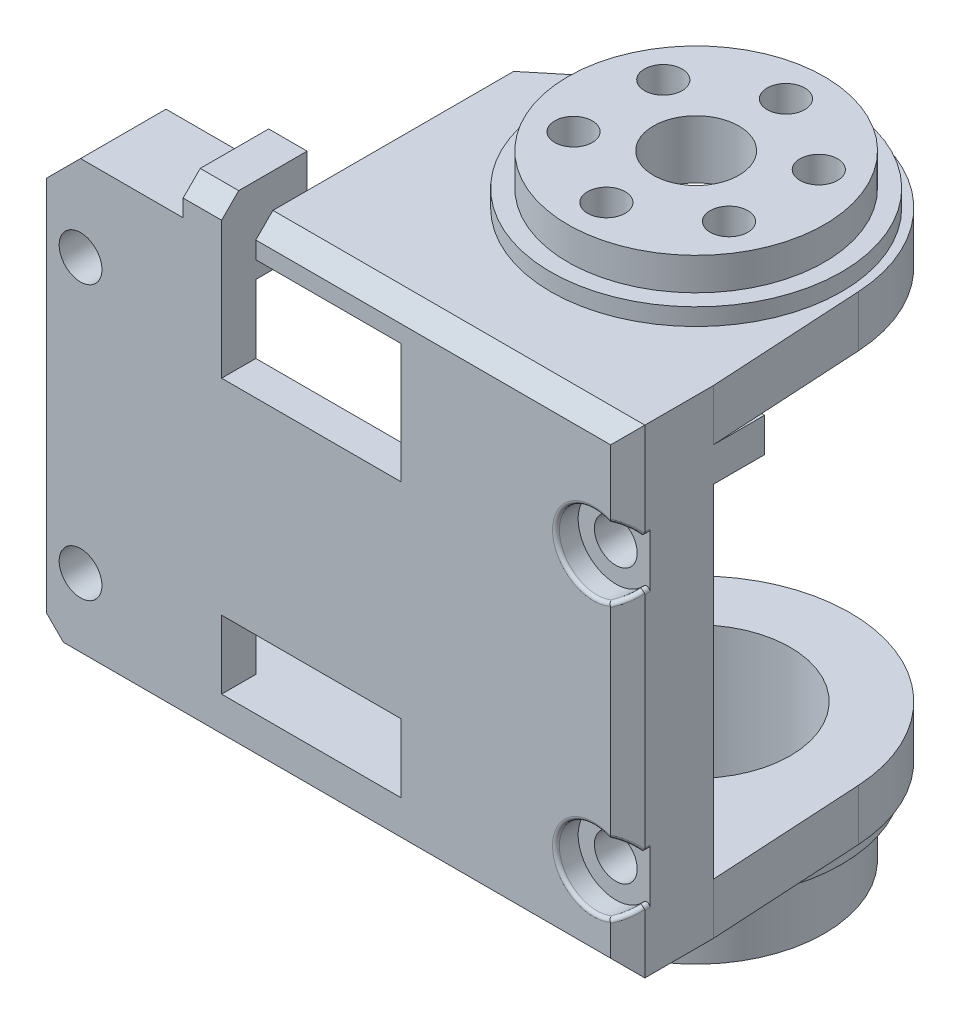
from build123d import *

# Parameters (mm, degrees)
SKETCH_1_W                     = 8
SKETCH_1_H                     = 2
EXTRUDE_1_DEPTH                = 2
SKETCH_2_W                     = 34
SKETCH_2_H                     = 2
SKETCH_2_R                     = 9
EXTRUDE_2_DEPTH                = 3
SKETCH_4_R                     = 7.5
EXTRUDE_3_DEPTH                = 5
SKETCH_5_R                     = 8.5
EXTRUDE_4_DEPTH                = 1
SKETCH_6_R                     = 7.5
CUT_EXTRUDE_1_DEPTH            = 2.1
CUT_EXTRUDE_2_DEPTH            = 45.014202253
CUT_EXTRUDE_2_DEPTH_BACK       = 45.014202253
SKETCH_7_W                     = 10.5
SKETCH_7_H                     = 4
SKETCH_8_W                     = 1.26
SKETCH_8_H                     = 2
EXTRUDE_5_DEPTH                = 3
SKETCH_9_W                     = 10.25
SKETCH_9_H                     = 2
EXTRUDE_6_DEPTH                = 3
SKETCH_10_W                    = 10.25
SKETCH_10_H                    = 5
CUT_EXTRUDE_3_DEPTH            = 43.699531613
SKETCH_11_W                    = 8
SKETCH_11_H                    = 2
CUT_EXTRUDE_4_DEPTH            = 43.699531613
SKETCH_21_W                    = 1.26
SKETCH_21_H                    = 2
EXTRUDE_7_DEPTH                = 3
EXTRUDE_8_DEPTH                = 3
FILLET_2_R                     = 1
HOLE_WIZARD_M2_1_D             = 2.5
CHAMFER_1_SIZE                 = 1
CHAMFER_2_SIZE                 = 2
CUT_EXTRUDE_5_REACH            = 56.324
SKETCH_14_R                    = 5.5
CUT_EXTRUDE_6_REACH            = 56.324
SKETCH_15_R                    = 2.5
HOLE_WIZARD_M2_1_2_D           = 2.2
HOLE_WIZARD_M2_1_2_DEPTH       = 5.9
HOLE_WIZARD_M2_1_2_CBORE_D     = 4.4
HOLE_WIZARD_M2_1_2_CBORE_DEPTH = 2.5
PATTERN_CIRCULAR_1_COUNT       = 6
CUT_EXTRUDE_7_DEPTH            = 2.5
FILLET_1_R                     = 0.4
SKETCH_22_R                    = 2.2
CUT_EXTRUDE_8_DEPTH            = 1.3
FILLET_3_R                     = 0.2


with BuildPart() as part:
    # 草图1 → 凸台-拉伸1 (new body)
    with BuildSketch(Plane.XY):
        Polygon((0, 14), (-26, 14), (-26, 12), (-34, 12), (-34, -14), (0, -14), align=None)
        with Locations((-30, 13)):
            Rectangle(SKETCH_1_W, SKETCH_1_H)
    extrude(amount=-EXTRUDE_1_DEPTH)

    # 草图2 → 凸台-拉伸2 (add)
    with BuildSketch(Plane.XZ.offset(14)):
        with Locations((-17, -1)):
            Rectangle(SKETCH_2_W, SKETCH_2_H)
        with BuildLine():
            Line((0, -2), (-34, -2))
            Line((-34, -2), (-34, -5))
            Line((-34, -5), (-15.217530313, -20.45052855))
            ThreePointArc((-15.217530313, -20.45052855), (-13.343320646, -5.361886803), (-0.5, -13.5))
            ThreePointArc((-0.5, -13.5), (-0.50365962, -13.756631572), (-0.514635503, -14.013054438))
            Line((-0.514635503, -14.013054438), (0, -5))
            Line((0, -5), (0, -2))
        make_face()
        with Locations((-9.5, -13.5)):
            Circle(SKETCH_2_R)
    extrude_2 = extrude(amount=-EXTRUDE_2_DEPTH)

    # 草图4 → 凸台-拉伸3 (add)
    with BuildSketch(Plane.XZ.offset(14)):
        with Locations(Location((-9.5, -13.5, 0), (0, 0, 180))):
            Circle(SKETCH_4_R)
    extrude_3 = extrude(amount=EXTRUDE_3_DEPTH)

    # 草图5 → 凸台-拉伸4 (add)
    with BuildSketch(Plane.XZ.offset(14)):
        with Locations(Location((-9.5, -13.5, 0), (0, 0, 180))):
            Circle(SKETCH_5_R)
    extrude_4 = extrude(amount=EXTRUDE_4_DEPTH)

    # 镜向1: 凸台-拉伸2, 凸台-拉伸3, 凸台-拉伸4 across plane
    add(extrude_2.mirror(Plane.ZX))
    add(extrude_3.mirror(Plane.ZX))
    add(extrude_4.mirror(Plane.ZX))

    # 草图6 → 切除-拉伸1 (cut)
    with BuildSketch(Plane(origin=(0, 19, 0), x_dir=(1, 0, 0), z_dir=(0, 1, 0))):
        with Locations(Location((-9.5, 13.5, 0), (0, 0, 180))):
            Circle(SKETCH_6_R)
    extrude(amount=-CUT_EXTRUDE_1_DEPTH, mode=Mode.SUBTRACT)

    # 草图7 → 切除-拉伸2 (cut, two sides: drawn at the far end of the back side and taken through both)
    with BuildSketch(Plane(origin=(0, 0, -2), x_dir=(-1, 0, 0), z_dir=(0, 0, -1)).offset(-CUT_EXTRUDE_2_DEPTH_BACK)):
        with Locations((18.5, -9)):
            Rectangle(SKETCH_7_W, SKETCH_7_H)
        Polygon((13.25, 12), (21.75, 12), (21.75, 14), (23.75, 14), (23.75, 5), (13.25, 5), align=None)
    extrude(amount=CUT_EXTRUDE_2_DEPTH + CUT_EXTRUDE_2_DEPTH_BACK, mode=Mode.SUBTRACT)

    # 草图8 → 凸台-拉伸5 (add)
    with BuildSketch(Plane(origin=(0, 0, -2), x_dir=(-1, 0, 0), z_dir=(0, 0, -1))):
        with Locations((0.63, 10)):
            Rectangle(SKETCH_8_W, SKETCH_8_H)
        with Locations((12.62, 10)):
            Rectangle(SKETCH_8_W, SKETCH_8_H)
    extrude(amount=EXTRUDE_5_DEPTH)

    # 草图9 → 凸台-拉伸6 (add)
    with BuildSketch(Plane(origin=(0, 0, -5), x_dir=(-1, 0, 0), z_dir=(0, 0, -1))):
        with Locations((28.875, 10)):
            Rectangle(SKETCH_9_W, SKETCH_9_H)
    extrude(amount=-EXTRUDE_6_DEPTH)

    # 草图10 → 切除-拉伸3 (cut, through all)
    with BuildSketch(Plane(origin=(0, 0, -5), x_dir=(-1, 0, 0), z_dir=(0, 0, -1))):
        with Locations((28.875, 11.5)):
            Rectangle(SKETCH_10_W, SKETCH_10_H)
    extrude(amount=CUT_EXTRUDE_3_DEPTH, mode=Mode.SUBTRACT)

    # 草图11 → 切除-拉伸4 (cut, through all)
    with BuildSketch(Plane(origin=(0, 0, -5), x_dir=(-1, 0, 0), z_dir=(0, 0, -1))):
        with Locations((30, 13)):
            Rectangle(SKETCH_11_W, SKETCH_11_H)
    extrude(amount=-CUT_EXTRUDE_4_DEPTH, mode=Mode.SUBTRACT)

    # 草图21 → 凸台-拉伸7 (add)
    with BuildSketch(Plane(origin=(0, 0, -5), x_dir=(-1, 0, 0), z_dir=(0, 0, -1))):
        with Locations((12.62, 10)):
            Rectangle(SKETCH_21_W, SKETCH_21_H)
        with Locations((0.63, 10)):
            Rectangle(SKETCH_21_W, SKETCH_21_H)
    extrude(amount=EXTRUDE_7_DEPTH)

    # 草图20 → 凸台-拉伸8 (add)
    with BuildSketch(Plane(origin=(0, 0, -2), x_dir=(-1, 0, 0), z_dir=(0, 0, -1))):
        with BuildLine():
            Line((9.5, 6), (13.25, 6))
            Line((13.25, 6), (13.25, 11))
            Line((13.25, 11), (0, 11))
            Line((0, 11), (0, -11))
            Line((0, -11), (13.25, -11))
            Line((13.25, -11), (13.25, -8))
            Line((13.25, -8), (9.5, -8))
            ThreePointArc((9.5, -8), (2.5, -1), (9.5, 6))
        make_face()
    extrude(amount=EXTRUDE_8_DEPTH)

    # 圆角2
    fillet_2_edges = [part.edges().sort_by_distance(p)[0] for p in [
        (-13.25, 6, -3.5),
        (-13.25, -8, -3.5),
    ]]
    fillet(fillet_2_edges, radius=FILLET_2_R)

    # Hole Wizard M2 _1 (through all)
    with Locations(Plane(origin=(0, 0, 0), x_dir=(-1, 0, 0), z_dir=(0, 0, 1))):
        with Locations((2, -7), (2, 9), (32, -7), (32, 9)):
            Hole(HOLE_WIZARD_M2_1_D / 2)

    # 倒角1
    # the kernel refuses this chamfer: 1 mm, written as the material it takes off along each edge
    with BuildSketch(Plane(origin=(-28.571682988, 14, 0), x_dir=(0, -0.9996219169112968, 0.02749587661058639), z_dir=(1, 0, 0))) as chamfer_1_piece_1:
        Polygon((CHAMFER_1_SIZE * 0.999621916911, CHAMFER_1_SIZE * 0.0274958766106), (-CHAMFER_1_SIZE * 0.0274958766106, CHAMFER_1_SIZE * 0.999621916911), (0, 0), align=None)
    extrude(amount=7.393365976, mode=Mode.SUBTRACT)
    with BuildSketch(Plane(origin=(0, 16.571682988, 0), x_dir=(-0.9996219169112968, 0, 0.027495876610586372), z_dir=(0, -1, 0))) as chamfer_1_piece_2:
        Polygon((CHAMFER_1_SIZE * 0.999621916911, CHAMFER_1_SIZE * 0.0274958766106), (-CHAMFER_1_SIZE * 0.0274958766106, CHAMFER_1_SIZE * 0.999621916911), (0, 0), align=None)
    extrude(amount=33.143365976, mode=Mode.SUBTRACT)
    with BuildSketch(Plane(origin=(-36.571682988, -14, 0), x_dir=(0, 0.9996219169112968, 0.02749587661058639), z_dir=(1, 0, 0))) as chamfer_1_piece_3:
        Polygon((CHAMFER_1_SIZE * 0.999621916911, -CHAMFER_1_SIZE * 0.0274958766106), (-CHAMFER_1_SIZE * 0.0274958766106, -CHAMFER_1_SIZE * 0.999621916911), (0, 0), align=None)
    extrude(amount=39.143365976, mode=Mode.SUBTRACT)
    with BuildSketch(Plane(origin=(-24.321682988, 14, 0), x_dir=(0, -0.9996219169112968, 0.02749587661058639), z_dir=(1, 0, 0))) as chamfer_1_piece_4:
        Polygon((CHAMFER_1_SIZE * 0.999621916911, CHAMFER_1_SIZE * 0.0274958766106), (-CHAMFER_1_SIZE * 0.0274958766106, CHAMFER_1_SIZE * 0.999621916911), (0, 0), align=None)
    extrude(amount=26.893365976, mode=Mode.SUBTRACT)

    # 倒角2
    chamfer_2_edges = [part.edges().sort_by_distance(p)[0] for p in [
        (-34, -14, -3),
        (-34, 12, -2.5),
    ]]
    chamfer(chamfer_2_edges, length=CHAMFER_2_SIZE)

    # 草图14 → 切除-拉伸5 (cut, up to next)
    with BuildSketch(Plane.XZ.offset(19), mode=Mode.PRIVATE) as cut_extrude_5_sk1:
        with Locations((-9.5, -13.5)):
            Circle(SKETCH_14_R)
    cut_extrude_5_tool1 = extrude(cut_extrude_5_sk1.sketch, amount=-CUT_EXTRUDE_5_REACH, mode=Mode.PRIVATE) & part.part
    add(cut_extrude_5_tool1.solids().sort_by_distance((-9.5, -19, -13.5))[0], mode=Mode.SUBTRACT)

    # 草图15 → 切除-拉伸6 (cut, up to next)
    with BuildSketch(Plane(origin=(0, 16.9, 0), x_dir=(1, 0, 0), z_dir=(0, 1, 0)), mode=Mode.PRIVATE) as cut_extrude_6_sk1:
        with Locations(Location((-9.5, 13.5, 0), (0, 0, 180))):
            Circle(SKETCH_15_R)
    cut_extrude_6_tool1 = extrude(cut_extrude_6_sk1.sketch, amount=-CUT_EXTRUDE_6_REACH, mode=Mode.PRIVATE) & part.part
    add(cut_extrude_6_tool1.solids().sort_by_distance((-9.5, 16.9, -13.5))[0], mode=Mode.SUBTRACT)

    # Hole Wizard M2 _1 2
    with Locations(Plane(origin=(0, 11, 0), x_dir=(-1, 0, 0), z_dir=(0, -1, 0))):
        with Locations((9.5, 18.75)):
            hole_wizard_m2_1_2 = CounterBoreHole(HOLE_WIZARD_M2_1_2_D / 2, HOLE_WIZARD_M2_1_2_CBORE_D / 2, HOLE_WIZARD_M2_1_2_CBORE_DEPTH, depth=HOLE_WIZARD_M2_1_2_DEPTH)

    # 阵列(圆周)1: Hole Wizard M2 _1 2 ×6 about axis
    pattern_circular_1_axis = Axis((-9.5, 0, -13.5), (0, 1, 0))
    for i in range(1, PATTERN_CIRCULAR_1_COUNT):
        add(hole_wizard_m2_1_2.rotate(pattern_circular_1_axis, i * 360 / PATTERN_CIRCULAR_1_COUNT), mode=Mode.SUBTRACT)

    # 草图19 → 切除-拉伸7 (cut)
    with BuildSketch(Plane.XZ.offset(-11)):
        Polygon((-5, -10.901923789), (-9.5, -8.303847577), (-14, -10.901923789), (-14, -16.098076211), (-9.5, -18.696152423), (-5, -16.098076211), align=None)
    extrude(amount=-CUT_EXTRUDE_7_DEPTH, mode=Mode.SUBTRACT)

    # 圆角1
    fillet_1_edges = [part.edges().sort_by_distance(p)[0] for p in [
        (-5, 12.25, -13.925494299),
        (-6.881511128, 12.25, -17.184367168),
        (-6.881511128, 12.25, -9.815632832),
        (-11.381511128, 12.25, -9.390138533),
        (-11.381511128, 12.25, -17.609861467),
        (-12.118488872, 12.25, -17.184367168),
        (-14, 12.75, -13.925494299),
        (-14, 12.75, -13.074505701),
        (-12.118488872, 12.25, -9.815632832),
        (-7.618488872, 12.25, -9.390138533),
        (-7.618488872, 12.25, -17.609861467),
        (-5, 12.25, -13.074505701),
    ]]
    fillet(fillet_1_edges, radius=FILLET_1_R)

    # 草图22 → 切除-拉伸8 (cut)
    with BuildSketch(Plane.XY):
        with Locations((-2, 7)):
            Circle(SKETCH_22_R)
        with Locations((-2, -9)):
            Circle(SKETCH_22_R)
    extrude(amount=-CUT_EXTRUDE_8_DEPTH, mode=Mode.SUBTRACT)

    # 圆角3
    fillet_3_edges = [part.edges().sort_by_distance(p)[0] for p in [
        (-0.439886289, -7.448856806, -0.560113711),
        (-0.439886289, -10.551143194, -0.560113711),
        (-0.439886289, 8.551143194, -0.560113711),
        (-0.439886289, 5.448856806, -0.560113711),
        (0, 6.083484861, -1.15),
        (0, 7.916515139, -1.15),
        (-4.2, 7, 0),
        (0, -9.916515139, -1.15),
        (0, -8.083484861, -1.15),
        (-4.2, -9, 0),
    ]]
    fillet(fillet_3_edges, radius=FILLET_3_R)


solid = part.part
